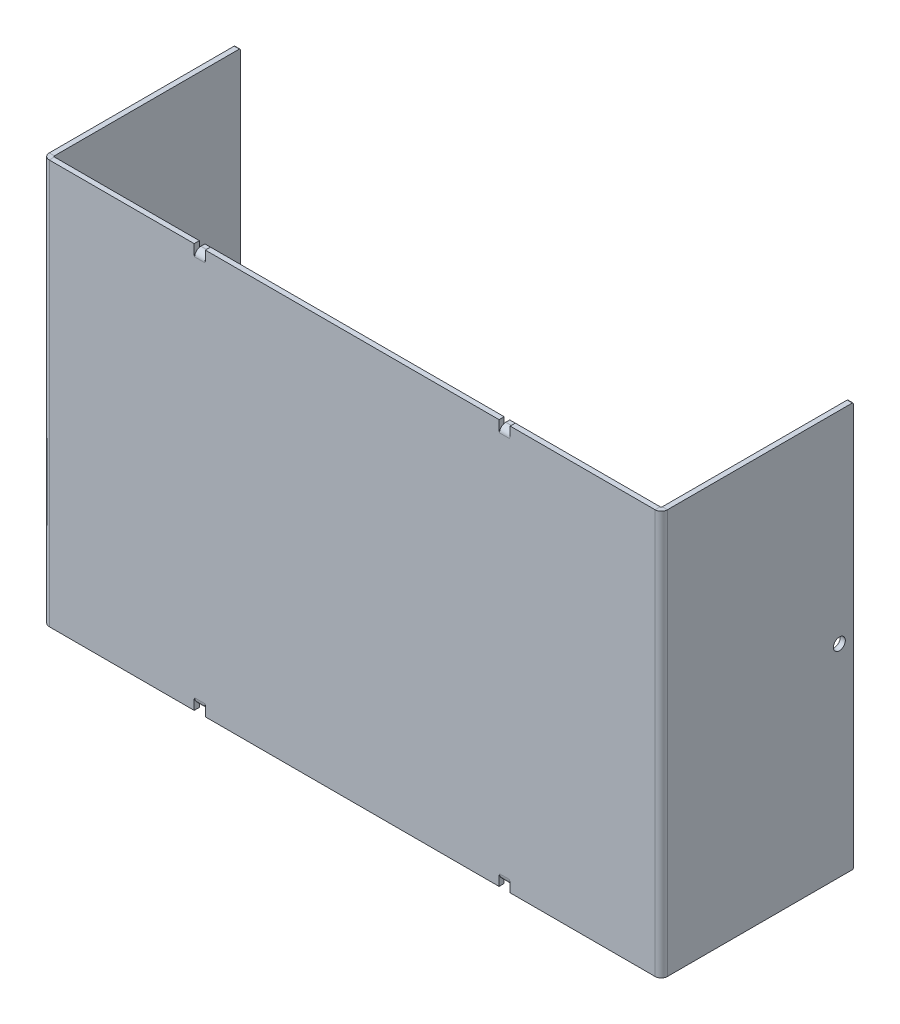
from build123d import *

# Parameters (mm, degrees)
SKETCH1_W                      = 152.4
SKETCH1_H                      = 101.6
BASE_FLANGE1_DEPTH             = 1.29032
EDGE_FLANGE1_STRIP_W           = 5.85978
EDGE_FLANGE1_STRIP_H           = 1.29032
EDGE_FLANGE1_STRIP_CUT_DEPTH   = 101.6
EDGE_FLANGE1_STRIP_2_W         = 5.85978
EDGE_FLANGE1_STRIP_2_H         = 1.29032
EDGE_FLANGE1_STRIP_CUT_2_DEPTH = 101.6
EDGE_FLANGE1_DEPTH             = 101.6
EDGE_FLANGE1_BEND_DEPTH        = 101.6
M3X0_5_TAPPED_HOLE1_REACH      = 172.432
M3X0_5_TAPPED_HOLE1_BORE_R     = 1.5
BREAK_CORNER1_START            = -77.68082
BREAK_CORNER1_DEPTH            = 155.36164
CUT_THICKEN1_START             = 48.26
CUT_THICKEN1_OUTLINE_W         = 0.127
CUT_THICKEN1_OUTLINE_H         = 1.29032
CUT_THICKEN1_DEPTH             = 2.54
CUT_THICKEN2_START             = 48.26
CUT_THICKEN2_OUTLINE_W         = 0.127
CUT_THICKEN2_OUTLINE_H         = 1.29032
CUT_THICKEN2_DEPTH             = 2.54
MIRROR7_START                  = 48.26
MIRROR7_COPY_1_SKETCH_W        = 0.127
MIRROR7_COPY_1_SKETCH_H        = 1.29032
MIRROR7_COPY_1_DEPTH           = 2.54
MIRROR7_COPY_2_SKETCH_W        = 0.127
MIRROR7_COPY_2_SKETCH_H        = 1.29032
MIRROR7_COPY_2_DEPTH           = 2.54
MOVE_FACE1_BY                  = 1.27
MOVE_FACE1_2_BY                = 1.27
MOVE_FACE1_3_BY                = 1.27
MOVE_FACE1_4_BY                = 1.27
EDGE_FLANGE2_STRIP_W           = 5.66928
EDGE_FLANGE2_STRIP_H           = 1.29032
EDGE_FLANGE2_STRIP_CUT_DEPTH   = 2.54
EDGE_FLANGE2_STRIP_2_W         = 5.66928
EDGE_FLANGE2_STRIP_2_H         = 1.29032
EDGE_FLANGE2_STRIP_CUT_2_DEPTH = 2.54
EDGE_FLANGE2_STRIP_3_W         = 5.66928
EDGE_FLANGE2_STRIP_3_H         = 1.29032
EDGE_FLANGE2_STRIP_CUT_3_DEPTH = 2.54
EDGE_FLANGE2_STRIP_4_W         = 5.66928
EDGE_FLANGE2_STRIP_4_H         = 1.29032
EDGE_FLANGE2_STRIP_CUT_4_DEPTH = 2.54
EDGE_FLANGE2_DEPTH             = 2.54
EDGE_FLANGE2_BEND_DEPTH        = 2.54
EDGE_FLANGE2_BEND_2_DEPTH      = 2.54
EDGE_FLANGE2_BEND_3_DEPTH      = 2.54


# Read off the part's stored shape, not the designer's step: Break-Corner1, Cut-Thicken1, Cut-Thicken2
# Sheet-metal steps are written as plain solids
with BuildPart() as part:
    # Sketch1 → Base-Flange1 (new body)
    with BuildSketch(Plane.XY):
        Rectangle(SKETCH1_W, SKETCH1_H)
    extrude(amount=-BASE_FLANGE1_DEPTH)

    # Edge-Flange1 strip (across the edge) → Edge-Flange1 strip cut (cut)
    with BuildSketch(Plane(origin=(-76.3905, -50.8, -1.29032), x_dir=(1, 0, 0), z_dir=(0, 1, 0))):
        with Locations((-2.67589, -0.64516)):
            Rectangle(EDGE_FLANGE1_STRIP_W, EDGE_FLANGE1_STRIP_H)
    extrude(amount=EDGE_FLANGE1_STRIP_CUT_DEPTH, mode=Mode.SUBTRACT)

    # Edge-Flange1 strip 2 (across the edge) → Edge-Flange1 strip cut 2 (cut)
    with BuildSketch(Plane(origin=(76.3905, 50.8, -1.29032), x_dir=(-1, 0, 0), z_dir=(0, -1, 0))):
        with Locations((-2.67589, -0.64516)):
            Rectangle(EDGE_FLANGE1_STRIP_2_W, EDGE_FLANGE1_STRIP_2_H)
    extrude(amount=EDGE_FLANGE1_STRIP_CUT_2_DEPTH, mode=Mode.SUBTRACT)

    # Edge-Flange1 section (across the edge) → Edge-Flange1 (add)
    with BuildSketch(Plane(origin=(-76.3905, -50.8, -1.29032), x_dir=(1, 0, 0), z_dir=(0, 1, 0))):
        with BuildLine():
            Line((-1.29032, 0.254), (-1.29032, 46.96968))
            Line((-1.29032, 46.96968), (0, 46.96968))
            Line((0, 46.96968), (0, 0.254))
            ThreePointArc((0, 0.254), (0.074394878, 0.074394878), (0.254, 0))
            Line((0.254, 0), (0.254, -1.29032))
            ThreePointArc((0.254, -1.29032), (-0.837999144, -0.837999144), (-1.29032, 0.254))
        make_face()
    extrude(amount=EDGE_FLANGE1_DEPTH)

    # Edge-Flange1 section 2 (across the edge) → Edge-Flange1 bend (add)
    with BuildSketch(Plane(origin=(76.3905, 50.8, -1.29032), x_dir=(-1, 0, 0), z_dir=(0, -1, 0))):
        with BuildLine():
            Line((-1.29032, 0.254), (-1.29032, 46.96968))
            Line((-1.29032, 46.96968), (0, 46.96968))
            Line((0, 46.96968), (0, 0.254))
            ThreePointArc((0, 0.254), (0.074394878, 0.074394878), (0.254, 0))
            Line((0.254, 0), (0.254, -1.29032))
            ThreePointArc((0.254, -1.29032), (-0.837999144, -0.837999144), (-1.29032, 0.254))
        make_face()
    extrude(amount=EDGE_FLANGE1_BEND_DEPTH)

    # M3x0.5 Tapped Hole1 bore → M3x0.5 Tapped Hole1 (cut, up to next)
    with BuildSketch(Plane.ZY.offset(77.68082), mode=Mode.PRIVATE) as m3x0_5_tapped_hole1_sk1:
        with Locations((-44.7675, 0)):
            Circle(M3X0_5_TAPPED_HOLE1_BORE_R)
    m3x0_5_tapped_hole1_tool1 = extrude(m3x0_5_tapped_hole1_sk1.sketch, amount=-M3X0_5_TAPPED_HOLE1_REACH, mode=Mode.PRIVATE) & part.part
    m3x0_5_tapped_hole1 = m3x0_5_tapped_hole1_tool1.solids().sort_by_distance((-77.68082, 0, -44.7675))[0]
    add(m3x0_5_tapped_hole1, mode=Mode.SUBTRACT)

    # Mirror1: M3x0.5 Tapped Hole1 across plane
    add(m3x0_5_tapped_hole1.mirror(Plane(origin=(0, 0, 0), x_dir=(0, 0, 1), z_dir=(1, 0, 0))), mode=Mode.SUBTRACT)

    # Break-Corner1 outline → Break-Corner1 (cut)
    with BuildSketch(Plane.YZ.offset(BREAK_CORNER1_START)):
        with BuildLine():
            Line((50.8, -48.26), (50.8, -48.006))
            ThreePointArc((50.8, -48.006), (50.725605122, -48.185605122), (50.546, -48.26))
            Line((50.546, -48.26), (50.8, -48.26))
        make_face()
        with BuildLine():
            Line((-50.8, -48.26), (-50.546, -48.26))
            ThreePointArc((-50.546, -48.26), (-50.725605122, -48.185605122), (-50.8, -48.006))
            Line((-50.8, -48.006), (-50.8, -48.26))
        make_face()
    extrude(amount=BREAK_CORNER1_DEPTH, mode=Mode.SUBTRACT)

    # Cut-Thicken1 outline → Cut-Thicken1 (cut)
    with BuildSketch(Plane(origin=(0, 0, 0), x_dir=(1, 0, 0), z_dir=(0, 1, 0)).offset(CUT_THICKEN1_START)):
        with Locations((36.97732, 0.64516)):
            Rectangle(CUT_THICKEN1_OUTLINE_W, CUT_THICKEN1_OUTLINE_H)
    cut_thicken1 = extrude(amount=CUT_THICKEN1_DEPTH, mode=Mode.SUBTRACT)

    # Cut-Thicken2 outline → Cut-Thicken2 (cut)
    with BuildSketch(Plane(origin=(0, 0, 0), x_dir=(1, 0, 0), z_dir=(0, 1, 0)).offset(CUT_THICKEN2_START)):
        with Locations((39.64432, 0.64516)):
            Rectangle(CUT_THICKEN2_OUTLINE_W, CUT_THICKEN2_OUTLINE_H)
    cut_thicken2 = extrude(amount=CUT_THICKEN2_DEPTH, mode=Mode.SUBTRACT)

    # Mirror6: Cut-Thicken1, Cut-Thicken2 across plane
    add(cut_thicken1.mirror(Plane(origin=(0, 0, 0), x_dir=(0, 0, 1), z_dir=(1, 0, 0))), mode=Mode.SUBTRACT)
    add(cut_thicken2.mirror(Plane(origin=(0, 0, 0), x_dir=(0, 0, 1), z_dir=(1, 0, 0))), mode=Mode.SUBTRACT)

    # Mirror7: Cut-Thicken1, Cut-Thicken2 across plane
    add(cut_thicken1.mirror(Plane.ZX), mode=Mode.SUBTRACT)
    add(cut_thicken2.mirror(Plane.ZX), mode=Mode.SUBTRACT)

    # Mirror7 copy 1 sketch → Mirror7 copy 1 (cut)
    with BuildSketch(Plane(origin=(0, 0, 0), x_dir=(-1, 0, 0), z_dir=(0, -1, 0)).offset(MIRROR7_START)):
        with Locations((36.97732, 0.64516)):
            Rectangle(MIRROR7_COPY_1_SKETCH_W, MIRROR7_COPY_1_SKETCH_H)
    extrude(amount=MIRROR7_COPY_1_DEPTH, mode=Mode.SUBTRACT)

    # Mirror7 copy 2 sketch → Mirror7 copy 2 (cut)
    with BuildSketch(Plane(origin=(0, 0, 0), x_dir=(-1, 0, 0), z_dir=(0, -1, 0)).offset(MIRROR7_START)):
        with Locations((39.64432, 0.64516)):
            Rectangle(MIRROR7_COPY_2_SKETCH_W, MIRROR7_COPY_2_SKETCH_H)
    extrude(amount=MIRROR7_COPY_2_DEPTH, mode=Mode.SUBTRACT)

    # Move Face1: a face moved inward by 1.27
    extrude(part.faces().sort_by_distance((-38.31082, -50.8, -0.64516))[0], amount=MOVE_FACE1_BY, dir=(0, 1, 0), mode=Mode.SUBTRACT)

    # Move Face1 2: a face moved inward by 1.27
    extrude(part.faces().sort_by_distance((38.31082, -50.8, -0.64516))[0], amount=MOVE_FACE1_2_BY, dir=(0, 1, 0), mode=Mode.SUBTRACT)

    # Move Face1 3: a face moved inward by 1.27
    extrude(part.faces().sort_by_distance((-38.31082, 50.8, -0.64516))[0], amount=MOVE_FACE1_3_BY, dir=(0, -1, 0), mode=Mode.SUBTRACT)

    # Move Face1 4: a face moved inward by 1.27
    extrude(part.faces().sort_by_distance((38.31082, 50.8, -0.64516))[0], amount=MOVE_FACE1_4_BY, dir=(0, -1, 0), mode=Mode.SUBTRACT)

    # Edge-Flange2 strip (across the edge) → Edge-Flange2 strip cut (cut)
    with BuildSketch(Plane(origin=(37.04082, 49.53, -1.29032), x_dir=(0, -1, 0), z_dir=(1, 0, 0))):
        with Locations((-1.29032, -0.64516)):
            Rectangle(EDGE_FLANGE2_STRIP_W, EDGE_FLANGE2_STRIP_H)
    extrude(amount=EDGE_FLANGE2_STRIP_CUT_DEPTH, mode=Mode.SUBTRACT)

    # Edge-Flange2 strip 2 (across the edge) → Edge-Flange2 strip cut 2 (cut)
    with BuildSketch(Plane(origin=(-39.58082, 49.53, -1.29032), x_dir=(0, -1, 0), z_dir=(1, 0, 0))):
        with Locations((-1.29032, -0.64516)):
            Rectangle(EDGE_FLANGE2_STRIP_2_W, EDGE_FLANGE2_STRIP_2_H)
    extrude(amount=EDGE_FLANGE2_STRIP_CUT_2_DEPTH, mode=Mode.SUBTRACT)

    # Edge-Flange2 strip 3 (across the edge) → Edge-Flange2 strip cut 3 (cut)
    with BuildSketch(Plane(origin=(39.58082, -49.53, -1.29032), x_dir=(0, 1, 0), z_dir=(-1, 0, 0))):
        with Locations((-1.29032, -0.64516)):
            Rectangle(EDGE_FLANGE2_STRIP_3_W, EDGE_FLANGE2_STRIP_3_H)
    extrude(amount=EDGE_FLANGE2_STRIP_CUT_3_DEPTH, mode=Mode.SUBTRACT)

    # Edge-Flange2 strip 4 (across the edge) → Edge-Flange2 strip cut 4 (cut)
    with BuildSketch(Plane(origin=(-37.04082, -49.53, -1.29032), x_dir=(0, 1, 0), z_dir=(-1, 0, 0))):
        with Locations((-1.29032, -0.64516)):
            Rectangle(EDGE_FLANGE2_STRIP_4_W, EDGE_FLANGE2_STRIP_4_H)
    extrude(amount=EDGE_FLANGE2_STRIP_CUT_4_DEPTH, mode=Mode.SUBTRACT)

    # Edge-Flange2 section (across the edge) → Edge-Flange2 (add)
    with BuildSketch(Plane(origin=(37.04082, 49.53, -1.29032), x_dir=(0, -1, 0), z_dir=(1, 0, 0))):
        with BuildLine():
            Line((0, 0.254), (0, 1.27))
            Line((0, 1.27), (1.29032, 1.27))
            Line((1.29032, 1.27), (1.29032, 0.254))
            ThreePointArc((1.29032, 0.254), (1.364714878, 0.074394878), (1.54432, 0))
            Line((1.54432, 0), (1.54432, -1.29032))
            ThreePointArc((1.54432, -1.29032), (0.452320856, -0.837999144), (0, 0.254))
        make_face()
    extrude(amount=EDGE_FLANGE2_DEPTH)

    # Edge-Flange2 section 2 (across the edge) → Edge-Flange2 bend (add)
    with BuildSketch(Plane(origin=(-39.58082, 49.53, -1.29032), x_dir=(0, -1, 0), z_dir=(1, 0, 0))):
        with BuildLine():
            Line((0, 0.254), (0, 1.27))
            Line((0, 1.27), (1.29032, 1.27))
            Line((1.29032, 1.27), (1.29032, 0.254))
            ThreePointArc((1.29032, 0.254), (1.364714878, 0.074394878), (1.54432, 0))
            Line((1.54432, 0), (1.54432, -1.29032))
            ThreePointArc((1.54432, -1.29032), (0.452320856, -0.837999144), (0, 0.254))
        make_face()
    extrude(amount=EDGE_FLANGE2_BEND_DEPTH)

    # Edge-Flange2 section 3 (across the edge) → Edge-Flange2 bend 2 (add)
    with BuildSketch(Plane(origin=(39.58082, -49.53, -1.29032), x_dir=(0, 1, 0), z_dir=(-1, 0, 0))):
        with BuildLine():
            Line((0, 0.254), (0, 1.27))
            Line((0, 1.27), (1.29032, 1.27))
            Line((1.29032, 1.27), (1.29032, 0.254))
            ThreePointArc((1.29032, 0.254), (1.364714878, 0.074394878), (1.54432, 0))
            Line((1.54432, 0), (1.54432, -1.29032))
            ThreePointArc((1.54432, -1.29032), (0.452320856, -0.837999144), (0, 0.254))
        make_face()
    extrude(amount=EDGE_FLANGE2_BEND_2_DEPTH)

    # Edge-Flange2 section 4 (across the edge) → Edge-Flange2 bend 3 (add)
    with BuildSketch(Plane(origin=(-37.04082, -49.53, -1.29032), x_dir=(0, 1, 0), z_dir=(-1, 0, 0))):
        with BuildLine():
            Line((0, 0.254), (0, 1.27))
            Line((0, 1.27), (1.29032, 1.27))
            Line((1.29032, 1.27), (1.29032, 0.254))
            ThreePointArc((1.29032, 0.254), (1.364714878, 0.074394878), (1.54432, 0))
            Line((1.54432, 0), (1.54432, -1.29032))
            ThreePointArc((1.54432, -1.29032), (0.452320856, -0.837999144), (0, 0.254))
        make_face()
    extrude(amount=EDGE_FLANGE2_BEND_3_DEPTH)


solid = part.part
